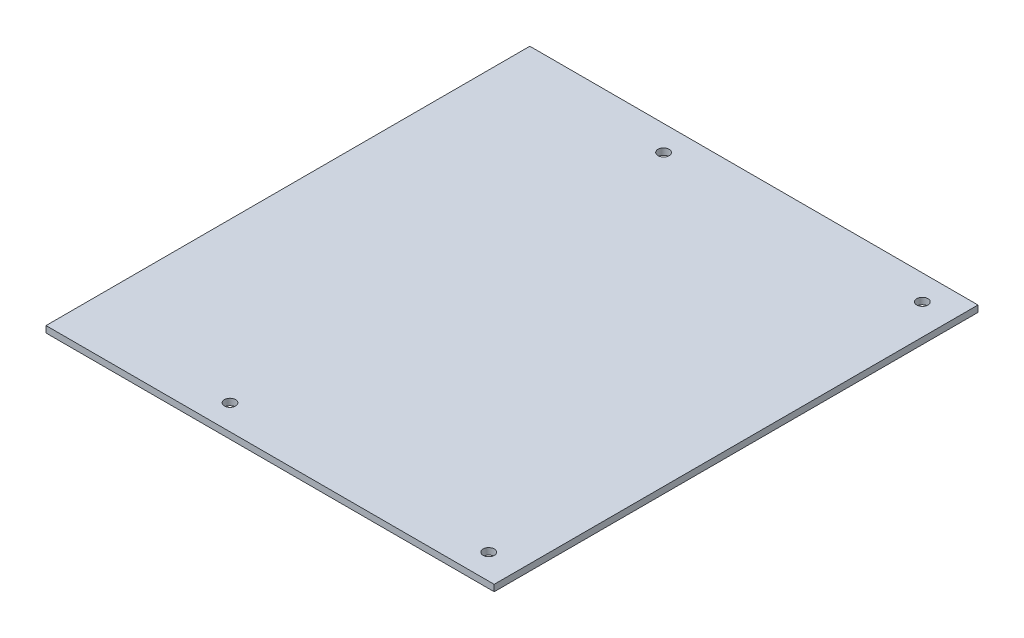
from build123d import *

# Parameters (mm, degrees)
SKETCH1_W            = 220
SKETCH1_H            = 237.5
BOSS_EXTRUDE1_DEPTH  = 1.5875
M5_CLEARANCE_HOLE1_D = 5.5


with BuildPart() as part:
    # Sketch1 → Boss-Extrude1 (new, symmetric)
    with BuildSketch(Plane(origin=(0, 0, 0), x_dir=(1, 0, 0), z_dir=(0, 1, 0))):
        Rectangle(SKETCH1_W, SKETCH1_H)
    extrude(amount=BOSS_EXTRUDE1_DEPTH, both=True)

    # M5 Clearance Hole1 (through all)
    with Locations(Plane(origin=(0, 1.5875, 0), x_dir=(1, 0, 0), z_dir=(0, 1, 0))):
        with Locations((-32, 106.425), (95, 106.425), (95, -106.425), (-32, -106.425)):
            Hole(M5_CLEARANCE_HOLE1_D / 2)


solid = part.part
